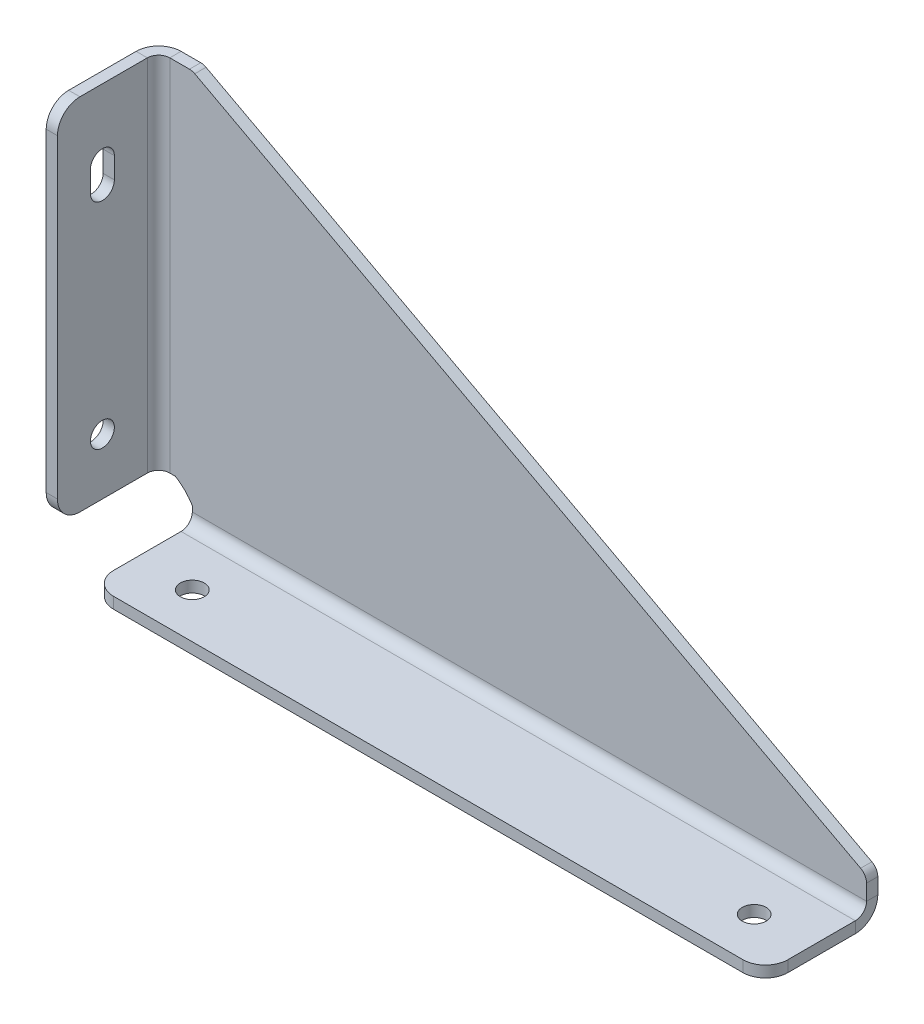
from build123d import *

# Parameters (mm, degrees)
BASE_FLANGE1_DEPTH                = 3.175
EDGE_FLANGE2_STRIP_W              = 19.05
EDGE_FLANGE2_STRIP_H              = 3.175
EDGE_FLANGE2_STRIP_CUT_DEPTH      = 190.5
EDGE_FLANGE2_RELIEF_W             = 20.6375
EDGE_FLANGE2_RELIEF_H             = 1.5875
EDGE_FLANGE2_RELIEF_CUT_DEPTH     = 3.175
EDGE_FLANGE2_STRIP_2_W            = 19.05
EDGE_FLANGE2_STRIP_2_H            = 3.175
EDGE_FLANGE2_STRIP_CUT_2_DEPTH    = 101.6
EDGE_FLANGE2_RELIEF_2_W           = 20.6375
EDGE_FLANGE2_RELIEF_2_H           = 1.5875
EDGE_FLANGE2_RELIEF_CUT_2_DEPTH   = 3.175
EDGE_FLANGE2_DEPTH                = 190.5
EDGE_FLANGE2_BEND_DEPTH           = 101.6
F_1_4_CLEARANCE_HOLE1_D           = 6.7564
F_1_4_CLEARANCE_HOLE1_ON_FACE_2_D = 6.7564
CUT_EXTRUDE1_DEPTH                = 235.885633075
FILLET1_R                         = 3.175
FILLET2_R                         = 6.35
F_1_4_CLEARANCE_SLOT1_DEPTH       = 3.175


# Read off the part's stored shape, not the designer's step: 1/4 Clearance Slot1
# Sheet-metal steps are written as plain solids
with BuildPart() as part:
    # Sketch3 → Base-Flange1 (new body)
    with BuildSketch(Plane.XY):
        with BuildLine():
            Line((0, 12.7), (0, 114.3))
            Line((0, 114.3), (12.7, 114.3))
            Line((12.7, 114.3), (203.2, 12.7))
            Line((203.2, 12.7), (203.2, 0))
            Line((203.2, 0), (12.7, 0))
            ThreePointArc((12.7, 0), (8.980256121, 8.980256121), (0, 12.7))
        make_face()
    extrude(amount=-BASE_FLANGE1_DEPTH)

    # Edge-Flange2 strip (across the edge) → Edge-Flange2 strip cut (cut)
    with BuildSketch(Plane.YZ.offset(12.7)):
        with Locations((-3.175, -1.5875)):
            Rectangle(EDGE_FLANGE2_STRIP_W, EDGE_FLANGE2_STRIP_H)
    extrude(amount=EDGE_FLANGE2_STRIP_CUT_DEPTH, mode=Mode.SUBTRACT)

    # Edge-Flange2 relief (on the sheet) → Edge-Flange2 relief cut (cut)
    with BuildSketch(Plane(origin=(12.7, 6.35, 0), x_dir=(0, 1, 0), z_dir=(0, 0, 1))):
        with Locations((-8.73125, 0.79375)):
            Rectangle(EDGE_FLANGE2_RELIEF_W, EDGE_FLANGE2_RELIEF_H)
    extrude(amount=-EDGE_FLANGE2_RELIEF_CUT_DEPTH, mode=Mode.SUBTRACT)

    # Edge-Flange2 strip 2 (across the edge) → Edge-Flange2 strip cut 2 (cut)
    with BuildSketch(Plane.XZ.offset(-114.3)):
        with Locations((-3.175, -1.5875)):
            Rectangle(EDGE_FLANGE2_STRIP_2_W, EDGE_FLANGE2_STRIP_2_H)
    extrude(amount=EDGE_FLANGE2_STRIP_CUT_2_DEPTH, mode=Mode.SUBTRACT)

    # Edge-Flange2 relief 2 (on the sheet) → Edge-Flange2 relief cut 2 (cut)
    with BuildSketch(Plane(origin=(6.35, 114.3, 0), x_dir=(1, 0, 0), z_dir=(0, 0, 1))):
        with Locations((-8.73125, -102.39375)):
            Rectangle(EDGE_FLANGE2_RELIEF_2_W, EDGE_FLANGE2_RELIEF_2_H)
    extrude(amount=-EDGE_FLANGE2_RELIEF_CUT_2_DEPTH, mode=Mode.SUBTRACT)

    # Edge-Flange2 section (across the edge) → Edge-Flange2 (add)
    with BuildSketch(Plane.YZ.offset(12.7)):
        with BuildLine():
            Line((0, 3.175), (0, 28.575))
            Line((0, 28.575), (3.175, 28.575))
            Line((3.175, 28.575), (3.175, 3.175))
            ThreePointArc((3.175, 3.175), (4.10493597, 0.92993597), (6.35, 0))
            Line((6.35, 0), (6.35, -3.175))
            ThreePointArc((6.35, -3.175), (1.859871939, -1.315128061), (0, 3.175))
        make_face()
    extrude(amount=EDGE_FLANGE2_DEPTH)

    # Edge-Flange2 section 2 (across the edge) → Edge-Flange2 bend (add)
    with BuildSketch(Plane.XZ.offset(-114.3)):
        with BuildLine():
            Line((0, 3.175), (0, 28.575))
            Line((0, 28.575), (3.175, 28.575))
            Line((3.175, 28.575), (3.175, 3.175))
            ThreePointArc((3.175, 3.175), (4.10493597, 0.92993597), (6.35, 0))
            Line((6.35, 0), (6.35, -3.175))
            ThreePointArc((6.35, -3.175), (1.859871939, -1.315128061), (0, 3.175))
        make_face()
    extrude(amount=EDGE_FLANGE2_BEND_DEPTH)

    # 1/4 Clearance Hole1 (through all)
    with Locations(Plane(origin=(3.175, 28.575, 15.875), x_dir=(0, 0, 1), z_dir=(1, 0, 0))):
        with Locations((0, 0), (0, -63.5)):
            Hole(F_1_4_CLEARANCE_HOLE1_D / 2)

    # 1/4 Clearance Hole1 on face 2 (through all)
    with Locations(Plane(origin=(28.575, 3.175, 15.875), x_dir=(0, 0, 1), z_dir=(0, 1, 0))):
        with Locations((0, 0), (0, 158.75)):
            Hole(F_1_4_CLEARANCE_HOLE1_ON_FACE_2_D / 2)

    # Sketch27 → Cut-Extrude1 (cut, through all)
    with BuildSketch(Plane.XY):
        with BuildLine():
            Line((7.9375, 12.7), (0, 12.7))
            Line((0, 12.7), (0, 0))
            Line((0, 0), (12.7, 0))
            Line((12.7, 0), (12.7, 7.9375))
            ThreePointArc((12.7, 7.9375), (10.589945851, 10.589945851), (7.9375, 12.7))
        make_face()
    extrude(amount=-CUT_EXTRUDE1_DEPTH, mode=Mode.SUBTRACT)

    # Fillet1
    fillet1_edges = [part.edges().sort_by_distance(p)[0] for p in [
        (12.7, 114.3, -1.5875),
        (203.2, 12.7, -1.5875),
    ]]
    fillet(fillet1_edges, radius=FILLET1_R)

    # Fillet2
    fillet2_edges = [part.edges().sort_by_distance(p)[0] for p in [
        (12.7, 1.5875, 28.575),
        (203.2, 1.5875, 28.575),
        (1.5875, 114.3, 28.575),
        (1.5875, 12.7, 28.575),
    ]]
    fillet(fillet2_edges, radius=FILLET2_R)

    # 1/4 Clearance Slot1 outline → 1/4 Clearance Slot1 (cut)
    with BuildSketch(Plane.YZ):
        with BuildLine():
            ThreePointArc((95.0468, 12.4968), (98.425, 15.875), (95.0468, 19.2532))
            Line((95.0468, 19.2532), (92.075, 19.2532))
            ThreePointArc((92.075, 19.2532), (95.4532, 15.875), (92.075, 12.4968))
            Line((92.075, 12.4968), (95.0468, 12.4968))
        make_face()
        with BuildLine():
            ThreePointArc((92.075, 12.4968), (88.6968, 15.875), (92.075, 19.2532))
            Line((92.075, 19.2532), (89.1032, 19.2532))
            ThreePointArc((89.1032, 19.2532), (85.725, 15.875), (89.1032, 12.4968))
            Line((89.1032, 12.4968), (92.075, 12.4968))
        make_face()
    extrude(amount=F_1_4_CLEARANCE_SLOT1_DEPTH, mode=Mode.SUBTRACT)


solid = part.part
